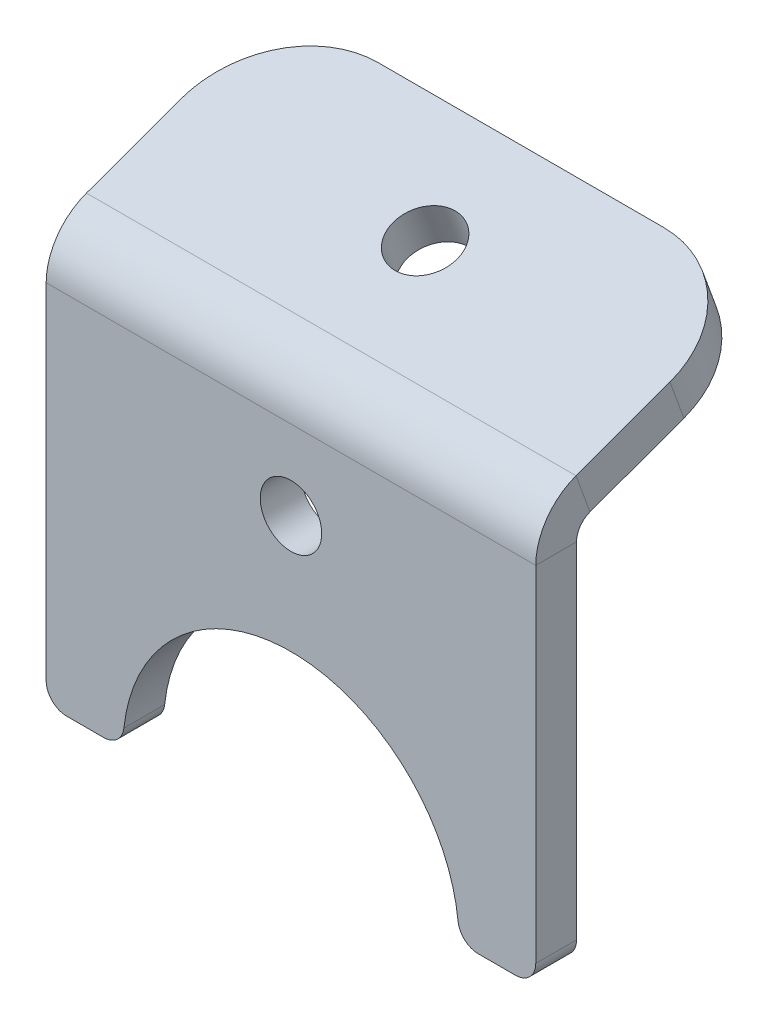
from build123d import *

# Parameters (mm, degrees)
BASE_FLANGE1_START = -38.1
BASE_FLANGE1_DEPTH = 76.2
SKETCH6_R          = 26.162
SKETCH6_R_2        = 4.7879
CUT_EXTRUDE1_DEPTH = 94.544815593
SKETCH7_R          = 4.9657
CUT_EXTRUDE2_DEPTH = 90.4661943
FILLET1_R          = 15.875
FILLET2_R          = 3.175


# Read off the part's stored shape, not the designer's step: Base-Flange1
with BuildPart() as part:
    # Base-Flange1 outline → Base-Flange1 (new body)
    with BuildSketch(Plane(origin=(0, 0, 0), x_dir=(0, 0, -1), z_dir=(1, 0, 0)).offset(BASE_FLANGE1_START)):
        with BuildLine():
            Line((0, 56.830523199), (0, 0))
            Line((0, 0), (6.35, 0))
            Line((6.35, 0), (6.35, 56.830523199))
            ThreePointArc((6.35, 56.830523199), (6.924192259, 58.651628384), (8.439086045, 59.81404727))
            Line((8.439086045, 59.81404727), (37.974116762, 70.563919319))
            Line((37.974116762, 70.563919319), (35.802288852, 76.530967461))
            Line((35.802288852, 76.530967461), (6.267258135, 65.781095412))
            ThreePointArc((6.267258135, 65.781095412), (1.722576778, 62.293838755), (0, 56.830523199))
        make_face()
    extrude(amount=BASE_FLANGE1_DEPTH)

    # Sketch6 → Cut-Extrude1 (cut, through all)
    with BuildSketch(Plane.XY):
        Circle(SKETCH6_R)
        with Locations((0, 44.45)):
            Circle(SKETCH6_R_2)
    extrude(amount=-CUT_EXTRUDE1_DEPTH, mode=Mode.SUBTRACT)

    # Sketch7 → Cut-Extrude2 (cut, through all)
    with BuildSketch(Plane(origin=(0, 56.071911069, 20.408506608), x_dir=(1, 0, 0), z_dir=(0, 0.9396926207859093, 0.34202014332566627))):
        with Locations(Location((0, 43.943279101, 0), (0, 0, 270))):
            Circle(SKETCH7_R)
    extrude(amount=-CUT_EXTRUDE2_DEPTH, mode=Mode.SUBTRACT)

    # Fillet1
    fillet1_edges = [part.edges().sort_by_distance(p)[0] for p in [
        (38.1, 73.54744339, -36.888202807),
        (-38.1, 73.54744339, -36.888202807),
    ]]
    fillet(fillet1_edges, radius=FILLET1_R)

    # Fillet2
    fillet2_edges = [part.edges().sort_by_distance(p)[0] for p in [
        (26.162, 0, -3.175),
        (-26.162, 0, -3.175),
        (38.1, 0, -3.175),
        (-38.1, 0, -3.175),
    ]]
    fillet(fillet2_edges, radius=FILLET2_R)


solid = part.part
